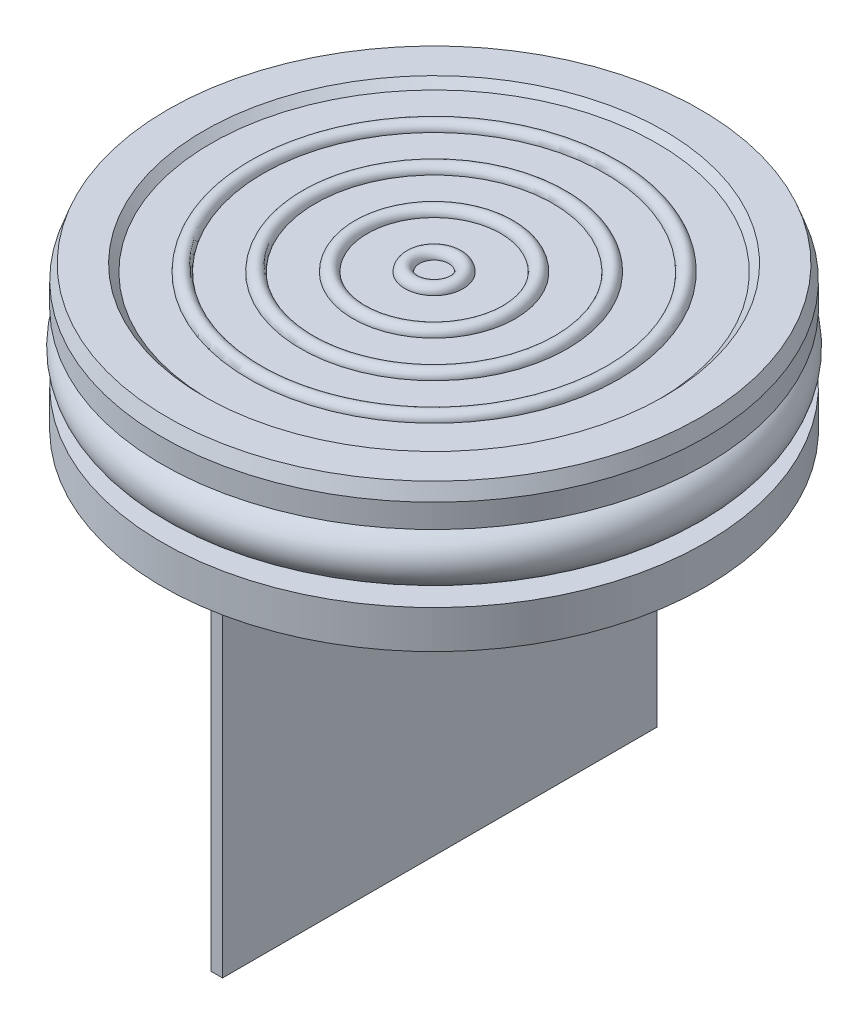
from build123d import *

# Parameters (mm, degrees)
BOSS_EXTRUDE1_START     = -7.592407231
BOSS_EXTRUDE1_OUTLINE_W = 0.396875
BOSS_EXTRUDE1_OUTLINE_H = 12.7
BOSS_EXTRUDE1_DEPTH     = 15.184814462


# Read off the part's stored shape, not the designer's step: Boss-Extrude1
with BuildPart() as part:
    # Sketch1 → Revolve1 (revolve)
    with BuildSketch(Plane.XY, mode=Mode.PRIVATE) as revolve1_sk:
        with BuildLine():
            Line((0, 2.388), (-0.508, 2.388))
            ThreePointArc((-0.508, 2.388), (-0.762, 2.642), (-1.016, 2.388))
            Line((-1.016, 2.388), (-2.32877578, 2.388))
            ThreePointArc((-2.32877578, 2.388), (-2.58277578, 2.642), (-2.83677578, 2.388))
            Line((-2.83677578, 2.388), (-4.14955156, 2.388))
            ThreePointArc((-4.14955156, 2.388), (-4.40355156, 2.642), (-4.65755156, 2.388))
            Line((-4.65755156, 2.388), (-5.970327341, 2.388))
            ThreePointArc((-5.970327341, 2.388), (-6.224327341, 2.642), (-6.478327341, 2.388))
            Line((-6.478327341, 2.388), (-7.791103121, 2.388))
            Line((-7.791103121, 2.388), (-8.045103121, 2.642))
            Line((-8.045103121, 2.642), (-9.315103121, 2.642))
            Line((-9.315103121, 2.642), (-9.5, 2.134))
            Line((-9.5, 2.134), (-9.5, 1.3081))
            Line((-9.5, 1.3081), (-8.23, 1.3081))
            Line((-8.23, 1.3081), (-8.23, 0.890828358))
            ThreePointArc((-8.23, 0.890828358), (-9.5768, 0.127), (-8.23, -0.636828358))
            Line((-8.23, -0.636828358), (-8.23, -1.0541))
            Line((-8.23, -1.0541), (-9.5, -1.0541))
            Line((-9.5, -1.0541), (-9.5, -2.388))
            Line((-9.5, -2.388), (-7.976, -2.388))
            Line((-7.976, -2.388), (-7.976, -1.3081))
            Line((-7.976, -1.3081), (-7.722, -1.3081))
            Line((-7.722, -1.3081), (-7.722, -2.007))
            Line((-7.722, -2.007), (-7.595, -2.007))
            Line((-7.595, -2.007), (-7.595, -2.388))
            Line((-7.595, -2.388), (0, -2.388))
            Line((0, -2.388), (0, 2.388))
        make_face()
    revolve(revolve1_sk.sketch.rotate(Axis((0, -2.388, 0), (0, 1, 0)), 180), axis=Axis((0, -2.388, 0), (0, 1, 0)))


with BuildPart() as body_2:
    # Boss-Extrude1 outline → Boss-Extrude1 (new body)
    with BuildSketch(Plane.XY.offset(BOSS_EXTRUDE1_START)):
        with Locations((0, -8.738)):
            Rectangle(BOSS_EXTRUDE1_OUTLINE_W, BOSS_EXTRUDE1_OUTLINE_H)
    extrude(amount=BOSS_EXTRUDE1_DEPTH)


solid = Compound([part.part, body_2.part])
